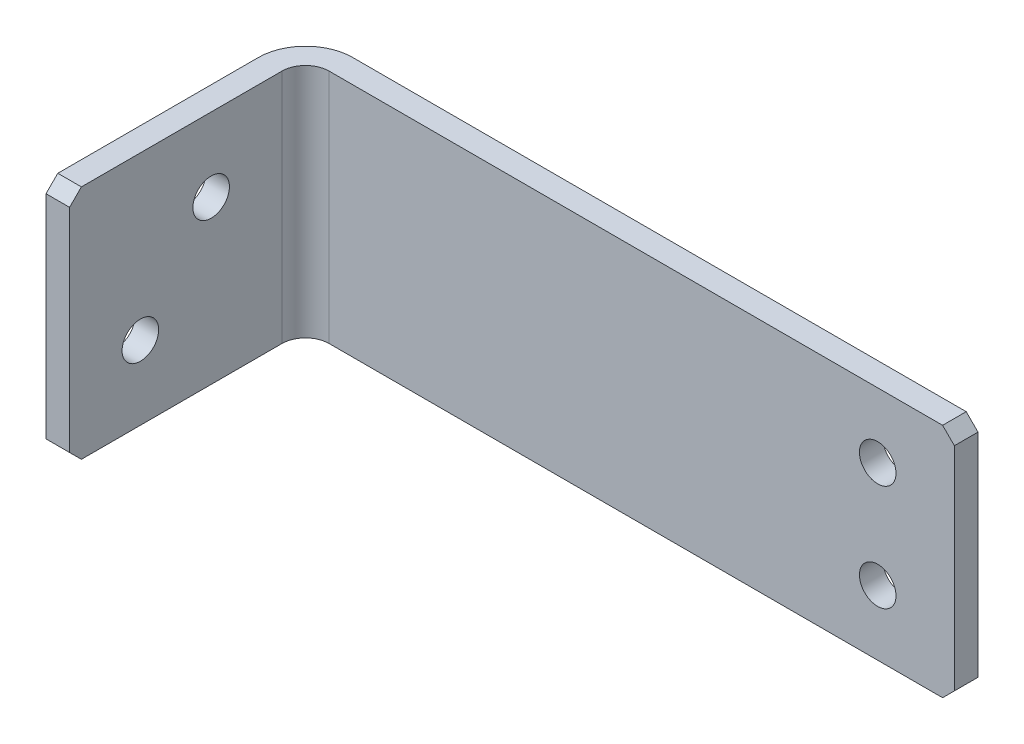
from build123d import *

# Parameters (mm, degrees)
BASE_DEPTH           = 20
SKETCH2_R            = 1.55
GUIDESIDEHOLES_DEPTH = 20
SKETCH3_R            = 1.55
FOOTSIDEHOLES_DEPTH  = 63.521996129
CHAMFER1_SIZE        = 1


with BuildPart() as part:
    # Sketch1 → Base (new body)
    with BuildSketch(Plane(origin=(0, 0, 0), x_dir=(1, 0, 0), z_dir=(0, 1, 0))):
        with BuildLine():
            Line((0, 0), (0, 18))
            ThreePointArc((0, 18), (0.585786438, 19.414213562), (2, 20))
            Line((2, 20), (55, 20))
            Line((55, 20), (55, 22))
            Line((55, 22), (2, 22))
            ThreePointArc((2, 22), (-0.828427125, 20.828427125), (-2, 18))
            Line((-2, 18), (-2, 0))
            Line((-2, 0), (0, 0))
        make_face()
    extrude(amount=BASE_DEPTH)

    # Sketch2 → GuideSideHoles (cut)
    with BuildSketch(Plane.ZY.offset(2)):
        with Locations((-12, 13.75)):
            Circle(SKETCH2_R)
        with Locations((-6, 6.25)):
            Circle(SKETCH2_R)
    extrude(amount=-GUIDESIDEHOLES_DEPTH, mode=Mode.SUBTRACT)

    # Sketch3 → FootSideHoles (cut, through all)
    with BuildSketch(Plane(origin=(0, 0, -22), x_dir=(-1, 0, 0), z_dir=(0, 0, -1))):
        with Locations((-48.5, 14.5)):
            Circle(SKETCH3_R)
        with Locations((-48.5, 5.5)):
            Circle(SKETCH3_R)
    extrude(amount=-FOOTSIDEHOLES_DEPTH, mode=Mode.SUBTRACT)

    # Chamfer1
    chamfer1_edges = [part.edges().sort_by_distance(p)[0] for p in [
        (-1, 0, 0),
        (-1, 20, 0),
        (55, 0, -21),
        (55, 20, -21),
    ]]
    chamfer(chamfer1_edges, length=CHAMFER1_SIZE)


solid = part.part
